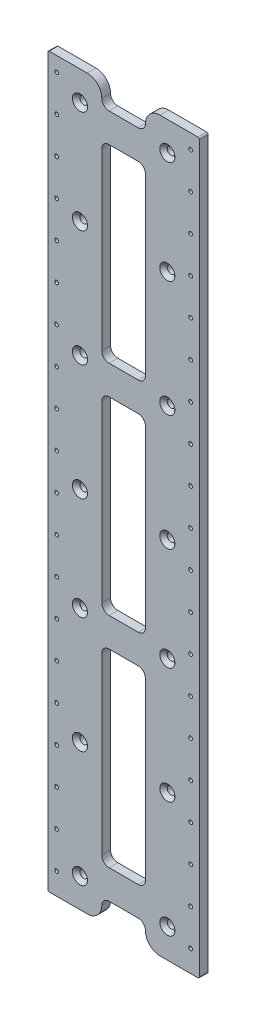
from build123d import *

# Parameters (mm, degrees)
BOSS_EXTRUDE1_DEPTH                                 = 6
CSK_FOR_M5_COUNTERSUNK_FLAT_HEAD_SCREW1_D           = 5.3
CSK_FOR_M5_COUNTERSUNK_FLAT_HEAD_SCREW1_CSINK_D     = 10.4
CSK_FOR_M5_COUNTERSUNK_FLAT_HEAD_SCREW1_CSINK_ANGLE = 90
F_2_6_2_6_DIAMETER_HOLE1_D                          = 2.6
FILLET1_R                                           = 10
FILLET2_R                                           = 1


with BuildPart() as part:
    # Sketch1 → Boss-Extrude1 (new body)
    with BuildSketch(Plane.XY):
        with BuildLine():
            Line((-15, -10), (-15, 0))
            Line((-15, 0), (-52, 0))
            Line((-52, 0), (-52, -500))
            Line((-52, -500), (-15, -500))
            Line((-15, -500), (-15, -490))
            ThreePointArc((-15, -490), (-13.535533906, -486.464466094), (-10, -485))
            Line((-10, -485), (10, -485))
            ThreePointArc((10, -485), (13.535533906, -486.464466094), (15, -490))
            Line((15, -490), (15, -500))
            Line((15, -500), (52, -500))
            Line((52, -500), (52, 0))
            Line((52, 0), (15, 0))
            Line((15, 0), (15, -10))
            ThreePointArc((15, -10), (13.535533906, -13.535533906), (10, -15))
            Line((10, -15), (-10, -15))
            ThreePointArc((-10, -15), (-13.535533906, -13.535533906), (-15, -10))
        make_face()
        with BuildLine():
            ThreePointArc((-15, -340), (-13.535533906, -336.464466094), (-10, -335))
            Line((-10, -335), (10, -335))
            ThreePointArc((10, -335), (13.535533906, -336.464466094), (15, -340))
            Line((15, -340), (15, -460))
            ThreePointArc((15, -460), (13.535533906, -463.535533906), (10, -465))
            Line((10, -465), (-10, -465))
            ThreePointArc((-10, -465), (-13.535533906, -463.535533906), (-15, -460))
            Line((-15, -460), (-15, -340))
        make_face(mode=Mode.SUBTRACT)
        with BuildLine():
            ThreePointArc((-15, -190), (-13.535533906, -186.464466094), (-10, -185))
            Line((-10, -185), (10, -185))
            ThreePointArc((10, -185), (13.535533906, -186.464466094), (15, -190))
            Line((15, -190), (15, -310))
            ThreePointArc((15, -310), (13.535533906, -313.535533906), (10, -315))
            Line((10, -315), (-10, -315))
            ThreePointArc((-10, -315), (-13.535533906, -313.535533906), (-15, -310))
            Line((-15, -310), (-15, -190))
        make_face(mode=Mode.SUBTRACT)
        with BuildLine():
            ThreePointArc((-15, -40), (-13.535533906, -36.464466094), (-10, -35))
            Line((-10, -35), (10, -35))
            ThreePointArc((10, -35), (13.535533906, -36.464466094), (15, -40))
            Line((15, -40), (15, -160))
            ThreePointArc((15, -160), (13.535533906, -163.535533906), (10, -165))
            Line((10, -165), (-10, -165))
            ThreePointArc((-10, -165), (-13.535533906, -163.535533906), (-15, -160))
            Line((-15, -160), (-15, -40))
        make_face(mode=Mode.SUBTRACT)
    extrude(amount=BOSS_EXTRUDE1_DEPTH)

    # CSK for M5 Countersunk Flat Head Screw1 (through all)
    with Locations(Plane.XY.offset(6)):
        with Locations((30, -480), (-30, -20), (30, -20), (-30, -90.666666667), (30, -90.666666667), (-30, -170.333333333), (30, -170.333333333), (30, -250), (-30, -250), (-30, -320.666666667), (30, -320.666666667), (-30, -400.333333333), (30, -400.333333333), (-30, -480)):
            CounterSinkHole(CSK_FOR_M5_COUNTERSUNK_FLAT_HEAD_SCREW1_D / 2, CSK_FOR_M5_COUNTERSUNK_FLAT_HEAD_SCREW1_CSINK_D / 2, counter_sink_angle=CSK_FOR_M5_COUNTERSUNK_FLAT_HEAD_SCREW1_CSINK_ANGLE)

    # Ø2.6 (2.6) Diameter Hole1 (through all)
    with Locations(Plane.XY.offset(6)):
        with Locations((-46, -510), (-46, -10), (46, -10), (46, -35), (46, -60), (46, -85), (46, -110), (46, -135), (46, -160), (46, -185), (46, -210), (46, -235), (46, -260), (46, -285), (46, -310), (46, -335), (46, -360), (46, -385), (46, -410), (46, -435), (46, -460), (46, -485), (46, -510), (-46, -35), (-46, -60), (-46, -85), (-46, -110), (-46, -135), (-46, -160), (-46, -185), (-46, -210), (-46, -235), (-46, -260), (-46, -285), (-46, -310), (-46, -335), (-46, -360), (-46, -385), (-46, -410), (-46, -435), (-46, -460), (-46, -485)):
            Hole(F_2_6_2_6_DIAMETER_HOLE1_D / 2)

    # Fillet1
    fillet1_edges = [part.edges().sort_by_distance(p)[0] for p in [
        (15, 0, 3),
        (-15, 0, 3),
        (15, -500, 3),
        (-15, -500, 3),
    ]]
    fillet(fillet1_edges, radius=FILLET1_R - 0.0001)  # a hair under: the kernel refuses the full size

    # Fillet2
    fillet2_edges = [part.edges().sort_by_distance(p)[0] for p in [
        (-52, -500, 3),
        (-52, 0, 3),
        (52, 0, 3),
        (52, -500, 3),
    ]]
    fillet(fillet2_edges, radius=FILLET2_R)


solid = part.part
